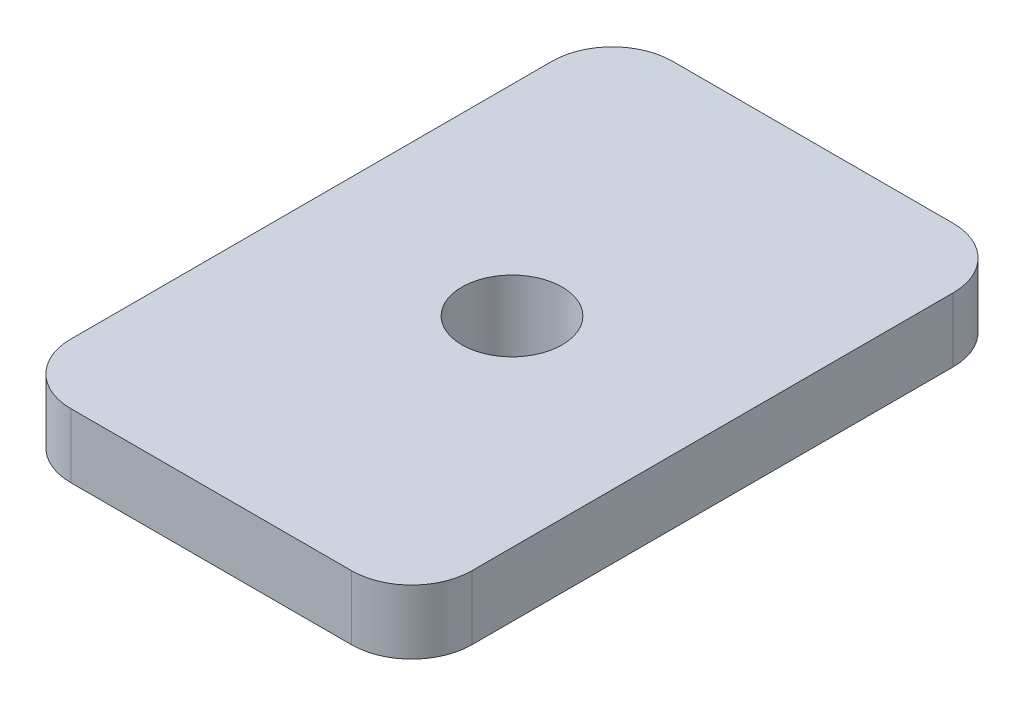
from build123d import *

# Parameters (mm, degrees)
SKETCH1_W             = 10
SKETCH1_H             = 15
BOSS_EXTRUDE1_DEPTH   = 1.6
FILLET1_R             = 1.5
SKETCH2_R             = 3.45
BOSS_EXTRUDE2_DEPTH   = 1.4
M3X0_5_TAPPED_HOLE1_D = 2.5


with BuildPart() as part:
    # Sketch1 → Boss-Extrude1 (new body)
    with BuildSketch(Plane(origin=(0, 0, 0), x_dir=(1, 0, 0), z_dir=(0, 1, 0))):
        with Locations((5, 7.5)):
            Rectangle(SKETCH1_W, SKETCH1_H)
    extrude(amount=BOSS_EXTRUDE1_DEPTH)

    # Fillet1
    fillet1_edges = [part.edges().sort_by_distance(p)[0] for p in [
        (0, 0.8, -15),
        (10, 0.8, -15),
        (0, 0.8, 0),
        (10, 0.8, 0),
    ]]
    fillet(fillet1_edges, radius=FILLET1_R)

    # Sketch2 → Boss-Extrude2 (add)
    with BuildSketch(Plane.XZ):
        with Locations((5, -7.5)):
            Circle(SKETCH2_R)
    extrude(amount=BOSS_EXTRUDE2_DEPTH)

    # M3x0.5 Tapped Hole1 (through all)
    with Locations(Plane(origin=(0, 1.6, 0), x_dir=(1, 0, 0), z_dir=(0, 1, 0))):
        with Locations((5, 7.5)):
            Hole(M3X0_5_TAPPED_HOLE1_D / 2)


solid = part.part
